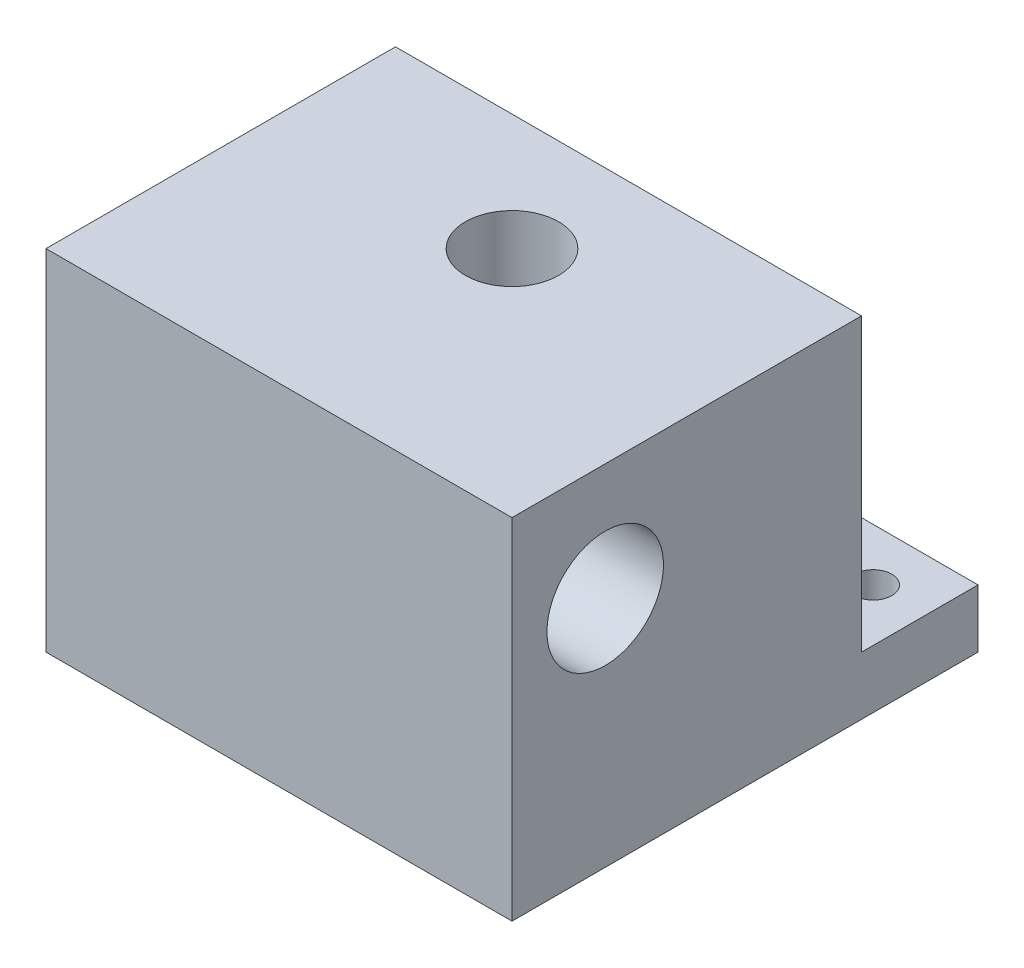
from build123d import *

# Parameters (mm, degrees)
SKETCH1_W                = 40
SKETCH1_H                = 40
BOSS_EXTRUDE1_DEPTH      = 30
SKETCH2_R                = 4
CUT_EXTRUDE1_DEPTH       = 42.231056256
CUT_EXTRUDE2_DEPTH       = 54.851648071
CUT_EXTRUDE2_DEPTH_BACK  = 54.851648071
SKETCH3_R                = 5
SKETCH4_W                = 10
SKETCH4_H                = 25
CUT_EXTRUDE3_DEPTH       = 54.851648071
M3_CLEARANCE_HOLE1_D     = 3.2
M3_CLEARANCE_HOLE1_DEPTH = 10.1
M3_CLEARANCE_HOLE1_TIP   = 0.96137699


with BuildPart() as part:
    # Sketch1 → Boss-Extrude1 (new body)
    with BuildSketch(Plane(origin=(0, 0, 0), x_dir=(1, 0, 0), z_dir=(0, 1, 0))):
        Rectangle(SKETCH1_W, SKETCH1_H)
    extrude(amount=BOSS_EXTRUDE1_DEPTH)

    # Sketch2 → Cut-Extrude1 (cut, through all)
    with BuildSketch(Plane(origin=(0, 30, 0), x_dir=(1, 0, 0), z_dir=(0, 1, 0))):
        Circle(SKETCH2_R)
    extrude(amount=-CUT_EXTRUDE1_DEPTH, mode=Mode.SUBTRACT)

    # Sketch3 → Cut-Extrude2 (cut, two sides: drawn at the far end of the back side and taken through both)
    with BuildSketch(Plane.ZY.offset(20).offset(-CUT_EXTRUDE2_DEPTH_BACK)):
        with Locations((12, 20)):
            Circle(SKETCH3_R)
    extrude(amount=CUT_EXTRUDE2_DEPTH + CUT_EXTRUDE2_DEPTH_BACK, mode=Mode.SUBTRACT)

    # Sketch4 → Cut-Extrude3 (cut, through all)
    with BuildSketch(Plane.ZY.offset(20)):
        with Locations((-15, 17.5)):
            Rectangle(SKETCH4_W, SKETCH4_H)
    extrude(amount=-CUT_EXTRUDE3_DEPTH, mode=Mode.SUBTRACT)

    # M3 Clearance Hole1
    with Locations(Plane(origin=(0, 5, 0), x_dir=(1, 0, 0), z_dir=(0, 1, 0))):
        with Locations((-15.5, 15.5), (15.5, 15.5)):
            Hole(M3_CLEARANCE_HOLE1_D / 2, depth=M3_CLEARANCE_HOLE1_DEPTH)
            with Locations((0, 0, -(M3_CLEARANCE_HOLE1_DEPTH + M3_CLEARANCE_HOLE1_TIP / 2))):  # 118° drill point
                Cone(0, M3_CLEARANCE_HOLE1_D / 2, M3_CLEARANCE_HOLE1_TIP, mode=Mode.SUBTRACT)


solid = part.part
